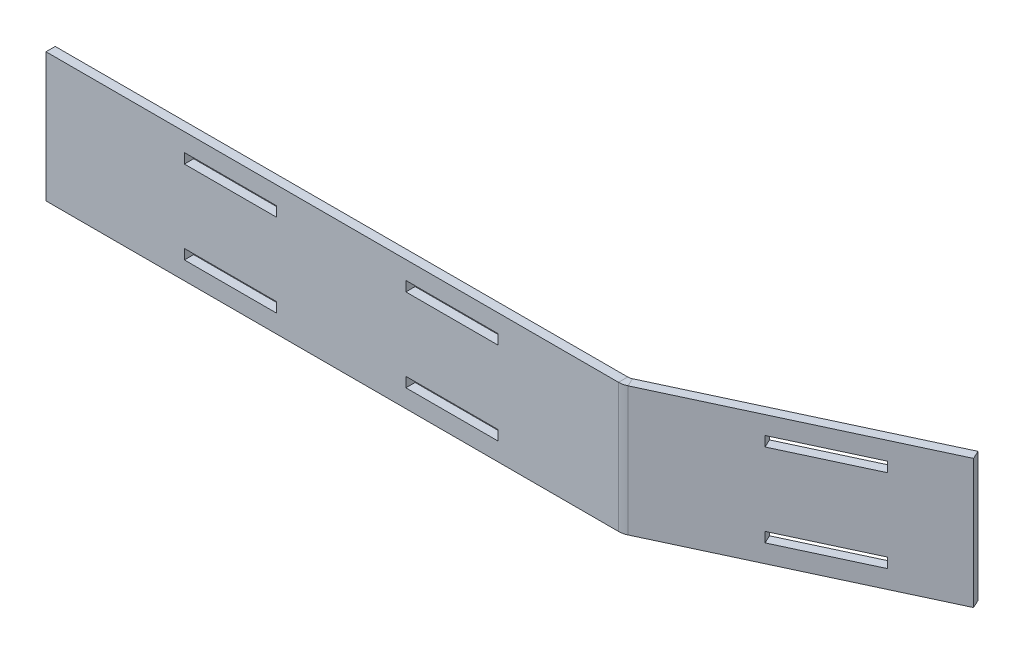
from build123d import *

# Parameters (mm, degrees)
BASE_FLANGE1_DEPTH = 44.45
SKETCH6_W          = 31.75
SKETCH6_H          = 3.429
CUT_EXTRUDE1_DEPTH = 287.781062931
SKETCH7_W          = 31.75
SKETCH7_H          = 3.429
CUT_EXTRUDE2_DEPTH = 275.16810415


# Sheet-metal steps are written as plain solids
with BuildPart() as part:
    # Sketch1 → Base-Flange1 (new body)
    with BuildSketch(Plane(origin=(0, 0, 0), x_dir=(1, 0, 0), z_dir=(0, 1, 0))):
        with BuildLine():
            Line((0, 0), (196.990405775, 0))
            ThreePointArc((196.990405775, 0), (197.677601549, 0.075260177), (198.332218756, 0.297472776))
            Line((198.332218756, 0.297472776), (279.4, 38.1))
            Line((279.4, 38.1), (280.741812981, 35.222472776))
            Line((280.741812981, 35.222472776), (199.674031737, -2.580054448))
            ThreePointArc((199.674031737, -2.580054448), (198.364797323, -3.024479645), (196.990405775, -3.175))
            Line((196.990405775, -3.175), (0, -3.175))
            Line((0, -3.175), (0, 0))
        make_face()
    extrude(amount=BASE_FLANGE1_DEPTH)

    # Sketch6 → Cut-Extrude1 (cut, through all)
    with BuildSketch(Plane(origin=(0, 0, 0), x_dir=(-1, 0, 0), z_dir=(0, 0, -1))):
        with Locations((-139.7, 7.9375)):
            Rectangle(SKETCH6_W, SKETCH6_H)
        with Locations((-63.5, 36.5125)):
            Rectangle(SKETCH6_W, SKETCH6_H)
        with Locations((-139.7, 36.5125)):
            Rectangle(SKETCH6_W, SKETCH6_H)
        with Locations((-63.5, 7.9375)):
            Rectangle(SKETCH6_W, SKETCH6_H)
    extrude(amount=-CUT_EXTRUDE1_DEPTH, mode=Mode.SUBTRACT)

    # Sketch7 → Cut-Extrude2 (cut, through all)
    with BuildSketch(Plane(origin=(35.309424285, 0, 75.721304739), x_dir=(-0.9063077870366493, 0, 0.42261826174070083), z_dir=(-0.4226182617407009, 0, -0.9063077870366494))):
        with Locations((-231.22415147, 36.5125)):
            Rectangle(SKETCH7_W, SKETCH7_H)
        with Locations((-231.22415147, 7.9375)):
            Rectangle(SKETCH7_W, SKETCH7_H)
    extrude(amount=-CUT_EXTRUDE2_DEPTH, mode=Mode.SUBTRACT)


solid = part.part
